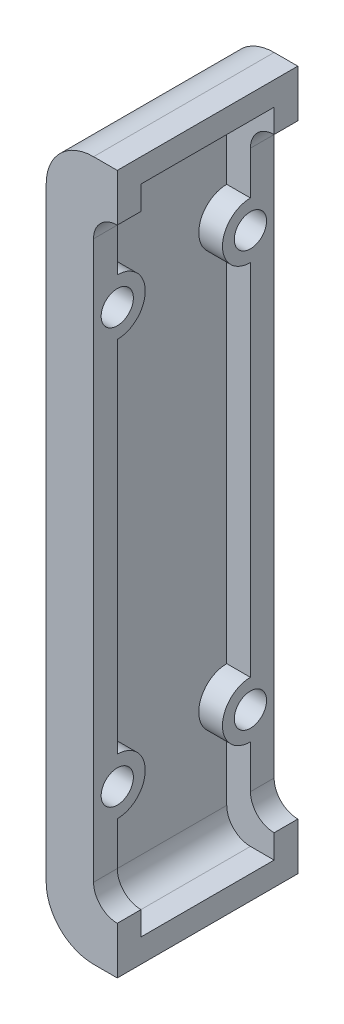
from build123d import *
from build123d.topology import SkipClean

# Parameters (mm, degrees)
BOSS_EXTRUDE1_DEPTH              = 19.05
CUT_EXTRUDE1_DEPTH               = 77.872247918
CUT_EXTRUDE1_DEPTH_BACK          = 5
SKETCH3_W                        = 28.1
SKETCH3_H                        = 137.6
FILLET1_R                        = 5
FILLET2_R                        = 10
TAP_DRILL_FOR_M8X1_25_TAP1_D     = 6.8
TAP_DRILL_FOR_M8X1_25_TAP1_DEPTH = 12
TAP_DRILL_FOR_M8X1_25_TAP1_TIP   = 2.042926105
BOSS_EXTRUDE2_START              = 5
BOSS_EXTRUDE2_DEPTH              = 5


with BuildPart() as part:
    # Sketch1 → Boss-Extrude1 (new, symmetric)
    with BuildSketch(Plane.XY):
        Polygon((0, 63.8), (0, -63.8), (5, -63.8), (5, -73.8), (-10, -73.8), (-10, 73.8), (5, 73.8), (5, 63.8), align=None)
    extrude(amount=BOSS_EXTRUDE1_DEPTH, both=True)

    # Sketch3 → Cut-Extrude1 (cut, two sides: drawn at the far end of the back side and taken through both)
    with BuildSketch(Plane(origin=(0, 0, 0), x_dir=(0, 0, -1), z_dir=(1, 0, 0)).offset(-CUT_EXTRUDE1_DEPTH_BACK)):
        Rectangle(SKETCH3_W, SKETCH3_H)
    extrude(amount=CUT_EXTRUDE1_DEPTH + CUT_EXTRUDE1_DEPTH_BACK, mode=Mode.SUBTRACT)

    # Fillet1
    fillet1_edges = [part.edges().sort_by_distance(p)[0] for p in [
        (0, -63.8, 16.55),
        (0, -63.8, -16.55),
        (0, 63.8, 16.55),
        (0, 63.8, -16.55),
        (-5, -68.8, 0),
        (-5, 68.8, 0),
    ]]
    fillet(fillet1_edges, radius=FILLET1_R - 0.0001)  # a hair under: the kernel refuses the full size

    # Fillet2
    fillet2_edges = [part.edges().sort_by_distance(p)[0] for p in [
        (-10, -73.8, 0),
        (-10, 73.8, 0),
    ]]
    fillet(fillet2_edges, radius=FILLET2_R)

    # Tap Drill for M8x1.25 Tap1
    with Locations(Plane.ZY.offset(10)):
        with Locations((-14.05, 43.8), (14.05, 43.8), (-14.05, -43.8), (14.05, -43.8)):
            Hole(TAP_DRILL_FOR_M8X1_25_TAP1_D / 2, depth=TAP_DRILL_FOR_M8X1_25_TAP1_DEPTH)
            with Locations((0, 0, -(TAP_DRILL_FOR_M8X1_25_TAP1_DEPTH + TAP_DRILL_FOR_M8X1_25_TAP1_TIP / 2))):  # 118° drill point
                Cone(0, TAP_DRILL_FOR_M8X1_25_TAP1_D / 2, TAP_DRILL_FOR_M8X1_25_TAP1_TIP, mode=Mode.SUBTRACT)

    # Sketch6 → Boss-Extrude2 (add)
    with SkipClean():  # the faces are left unmerged after this step: merging them gives an invalid solid
        with BuildSketch(Plane(origin=(-5, 0, 0), x_dir=(0, 0, -1), z_dir=(1, 0, 0)).offset(BOSS_EXTRUDE2_START)):
            with BuildLine():
                Line((14.05, -40.4), (14.05, -37.9))
                ThreePointArc((14.05, -37.9), (8.15, -43.8), (14.05, -49.7))
                Line((14.05, -49.7), (14.05, -47.2))
                ThreePointArc((14.05, -47.2), (10.65, -43.8), (14.05, -40.4))
            make_face()
            with BuildLine():
                ThreePointArc((-14.05, -49.7), (-8.15, -43.8), (-14.05, -37.9))
                Line((-14.05, -37.9), (-14.05, -40.4))
                ThreePointArc((-14.05, -40.4), (-10.65, -43.8), (-14.05, -47.2))
                Line((-14.05, -47.2), (-14.05, -49.7))
            make_face()
            with BuildLine():
                Line((14.05, 47.2), (14.05, 49.7))
                ThreePointArc((14.05, 49.7), (8.15, 43.8), (14.05, 37.9))
                Line((14.05, 37.9), (14.05, 40.4))
                ThreePointArc((14.05, 40.4), (10.65, 43.8), (14.05, 47.2))
            make_face()
            with BuildLine():
                ThreePointArc((-14.05, 49.7), (-8.15, 43.8), (-14.05, 37.9))
                Line((-14.05, 37.9), (-14.05, 40.4))
                ThreePointArc((-14.05, 40.4), (-10.65, 43.8), (-14.05, 47.2))
                Line((-14.05, 47.2), (-14.05, 49.7))
            make_face()
        extrude(amount=-BOSS_EXTRUDE2_DEPTH)


solid = part.part
